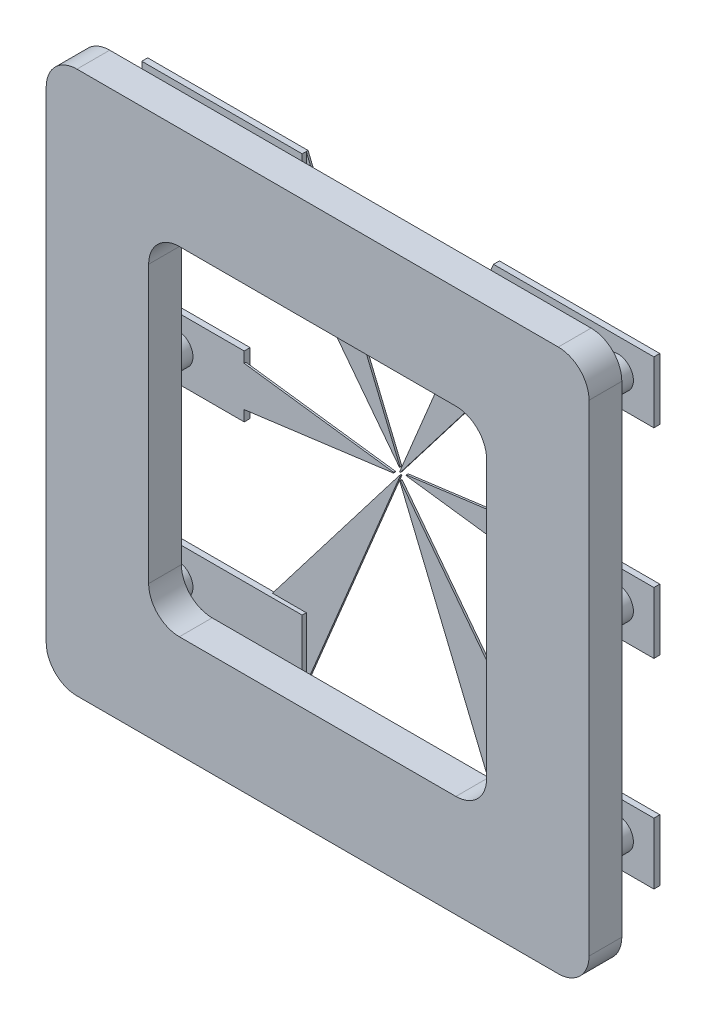
from build123d import *

# Parameters (mm, degrees)
EXTRUDE_1_DEPTH   = 0.178
EXTRUDE_1_2_DEPTH = 0.178
EXTRUDE_1_3_DEPTH = 0.178
EXTRUDE_2_DEPTH   = 0.178
EXTRUDE_2_2_DEPTH = 0.178
EXTRUDE_2_3_DEPTH = 0.178
EXTRUDE_3_DEPTH   = 0.5773
SKETCH_6_W        = 10
SKETCH_6_H        = 6
EXTRUDE_4_DEPTH   = 0.51
SKETCH_7_R        = 1.5
EXTRUDE_5_DEPTH   = 4.63
EXTRUDE_8_DEPTH   = 3.2


with BuildPart() as part:
    # 草圖1 → 填料-伸長1 (new body)
    with BuildSketch(Plane.XY):
        with BuildLine():
            Line((15, 1.956152303), (0.442778952, 0.039657794))
            ThreePointArc((0.442778952, 0.039657794), (0.408, 0), (0.442778952, -0.039657794))
            Line((0.442778952, -0.039657794), (15, -1.956152303))
            Line((15, -1.956152303), (15, -3))
            Line((15, -3), (25, -3))
            Line((25, -3), (25, 3))
            Line((25, 3), (15, 3))
            Line((15, 3), (15, 1.956152303))
        make_face()
    extrude(amount=EXTRUDE_1_DEPTH)



with BuildPart() as body_2:
    # 草圖1 → Extrude 1 2 (new body)
    with BuildSketch(Plane.XY):
        with BuildLine():
            Line((-9.339803144, 22.5), (-25, 22.5))
            Line((-25, 22.5), (-25, 16.5))
            Line((-25, 16.5), (-12.637607148, 16.5))
            Line((-12.637607148, 16.5), (-0.255734134, 0.363628924))
            ThreePointArc((-0.255734134, 0.363628924), (-0.204, 0.353338365), (-0.187044819, 0.403286718))
            Line((-0.187044819, 0.403286718), (-9.339803144, 22.5))
        make_face()
    extrude(amount=EXTRUDE_1_2_DEPTH)


with BuildPart() as body_3:
    # 草圖1 → Extrude 1 3 (new body)
    with BuildSketch(Plane.XY):
        with BuildLine():
            Line((-9.339803144, -22.5), (-0.187044819, -0.403286718))
            ThreePointArc((-0.187044819, -0.403286718), (-0.204, -0.353338365), (-0.255734134, -0.363628924))
            Line((-0.255734134, -0.363628924), (-12.637607148, -16.5))
            Line((-12.637607148, -16.5), (-25, -16.5))
            Line((-25, -16.5), (-25, -22.5))
            Line((-25, -22.5), (-9.339803144, -22.5))
        make_face()
    extrude(amount=EXTRUDE_1_3_DEPTH)


with BuildPart() as body_4:
    # 草圖3 → 填料-伸長2 (new body)
    with BuildSketch(Plane.XY.offset(0.5773)):
        with BuildLine():
            ThreePointArc((-0.443078952, -0.039657794), (-0.4083, 0), (-0.443078952, 0.039657794))
            Line((-0.443078952, 0.039657794), (-15, 1.956112808))
            Line((-15, 1.956112808), (-15, 3))
            Line((-15, 3), (-25, 3))
            Line((-25, 3), (-25, -3))
            Line((-25, -3), (-15, -3))
            Line((-15, -3), (-15, -1.956112808))
            Line((-15, -1.956112808), (-0.443078952, -0.039657794))
        make_face()
    extrude(amount=-EXTRUDE_2_DEPTH)



with BuildPart() as body_5:
    # 草圖3 → Extrude 2 2 (new body)
    with BuildSketch(Plane.XY.offset(0.5773)):
        with BuildLine():
            Line((9.339845528, 22.5), (0.187194819, 0.403546526))
            ThreePointArc((0.187194819, 0.403546526), (0.20415, 0.353598172), (0.255884134, 0.363888731))
            Line((0.255884134, 0.363888731), (12.637557791, 16.5))
            Line((12.637557791, 16.5), (25, 16.5))
            Line((25, 16.5), (25, 22.5))
            Line((25, 22.5), (9.339845528, 22.5))
        make_face()
    extrude(amount=-EXTRUDE_2_2_DEPTH)


with BuildPart() as body_6:
    # 草圖3 → Extrude 2 3 (new body)
    with BuildSketch(Plane.XY.offset(0.5773)):
        with BuildLine():
            Line((9.339845528, -22.5), (25, -22.5))
            Line((25, -22.5), (25, -16.5))
            Line((25, -16.5), (12.637557791, -16.5))
            Line((12.637557791, -16.5), (0.255884134, -0.363888731))
            ThreePointArc((0.255884134, -0.363888731), (0.20415, -0.353598172), (0.187194819, -0.403546526))
            Line((0.187194819, -0.403546526), (9.339845528, -22.5))
        make_face()
    extrude(amount=-EXTRUDE_2_3_DEPTH)


with BuildPart() as part_1:
    add(part.part)

    add(body_2.part)  # 填料-伸長3 merges body 2

    add(body_3.part)  # 填料-伸長3 merges body 3
    # 草圖5 → 填料-伸長3 (add)
    with BuildSketch(Plane.XY):
        Polygon((-25, -22.5), (-9.339803144, -22.5), (-9.339803144, -16.5), (-12.637607148, -16.5), (-25, -16.5), align=None)
        Polygon((-25, 16.5), (-25, 22.5), (-9.339803144, 22.5), (-9.339803144, 16.5), (-12.637607148, 16.5), align=None)
        Polygon((15, -1.956152303), (15, -3), (25, -3), (25, 3), (15, 3), (15, 1.956152303), align=None)
    extrude(amount=EXTRUDE_3_DEPTH)



with BuildPart() as body_4_1:
    add(body_4.part)

    add(body_5.part)  # 填料-伸長4 merges body 5

    add(body_6.part)  # 填料-伸長4 merges body 6
    # 草圖6 → 填料-伸長4 (add)
    with BuildSketch(Plane.XY):
        Polygon((25, -22.5), (9.339845528, -22.5), (9.339845528, -16.5), (12.637557791, -16.5), (25, -16.5), align=None)
        with Locations((-20, 0)):
            Rectangle(SKETCH_6_W, SKETCH_6_H)
        Polygon((25, 16.5), (25, 22.5), (9.339845528, 22.5), (9.339845528, 16.5), (12.637557791, 16.5), align=None)
    extrude(amount=EXTRUDE_4_DEPTH)


with BuildPart() as part_2:
    add(part_1.part)

    add(body_4_1.part)  # 填料-伸長5 merges body 4
    # 草圖7 → 填料-伸長5 (add)
    with BuildSketch(Plane.XY.offset(0.5773)):
        with Locations((-21.501569391, -19.5)):
            Circle(SKETCH_7_R)
        with Locations((21.501569391, -19.5)):
            Circle(SKETCH_7_R)
        with Locations((-21.501569391, 0)):
            Circle(SKETCH_7_R)
        with Locations((21.501569391, 0)):
            Circle(SKETCH_7_R)
        with Locations((-21.501569391, 19.5)):
            Circle(SKETCH_7_R)
        with Locations((21.501569391, 19.5)):
            Circle(SKETCH_7_R)
    extrude(amount=EXTRUDE_5_DEPTH)

    # 草圖8 → 填料-伸長8 (add)
    with BuildSketch(Plane.XY.offset(5.2073)):
        with BuildLine():
            Line((-23.5, -26.5), (23.5, -26.5))
            ThreePointArc((23.5, -26.5), (25.621320344, -25.621320344), (26.5, -23.5))
            Line((26.5, -23.5), (26.5, 23.5))
            ThreePointArc((26.5, 23.5), (25.621320344, 25.621320344), (23.5, 26.5))
            Line((23.5, 26.5), (-23.5, 26.5))
            ThreePointArc((-23.5, 26.5), (-25.621320344, 25.621320344), (-26.5, 23.5))
            Line((-26.5, 23.5), (-26.5, -23.5))
            ThreePointArc((-26.5, -23.5), (-25.621320344, -25.621320344), (-23.5, -26.5))
        make_face()
        with BuildLine():
            Line((-13.5, -16.5), (13.5, -16.5))
            ThreePointArc((13.5, -16.5), (15.621320344, -15.621320344), (16.5, -13.5))
            Line((16.5, -13.5), (16.5, 13.5))
            ThreePointArc((16.5, 13.5), (15.621320344, 15.621320344), (13.5, 16.5))
            Line((13.5, 16.5), (-13.5, 16.5))
            ThreePointArc((-13.5, 16.5), (-15.621320344, 15.621320344), (-16.5, 13.5))
            Line((-16.5, 13.5), (-16.5, -13.5))
            ThreePointArc((-16.5, -13.5), (-15.621320344, -15.621320344), (-13.5, -16.5))
        make_face(mode=Mode.SUBTRACT)
    extrude(amount=EXTRUDE_8_DEPTH)


solid = part_2.part
